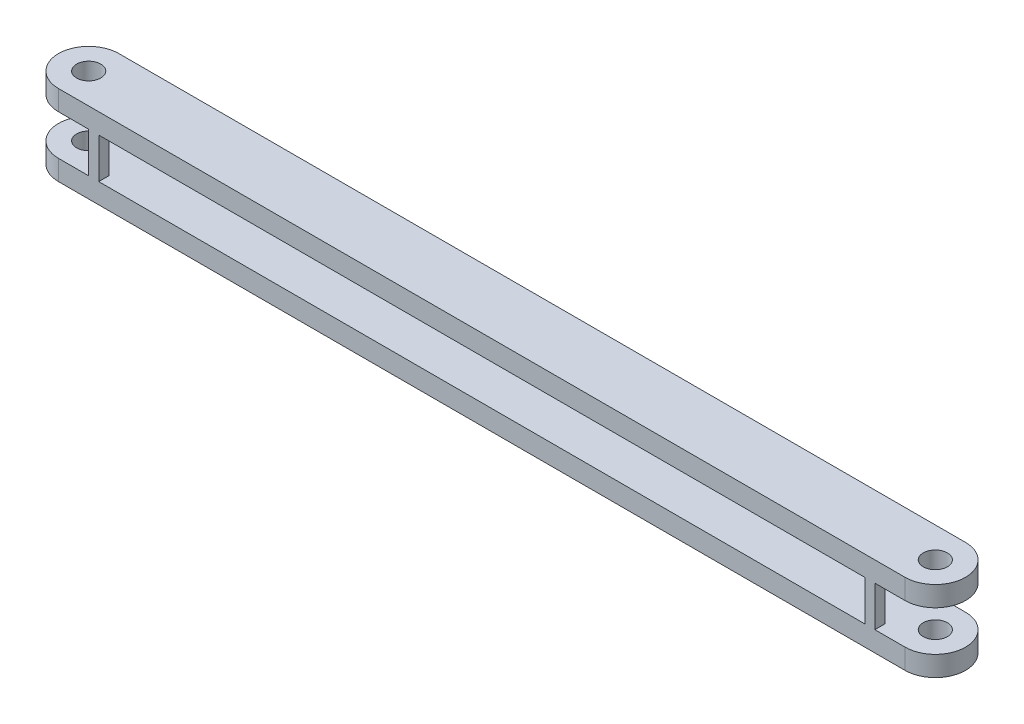
from build123d import *

# Parameters (mm, degrees)
EXTRUDE_1_DEPTH     = 20
SKETCH_2_W          = 190
SKETCH_2_H          = 10
CUT_EXTRUDE_3_DEPTH = 116.244305716
SKETCH_3_W          = 15
SKETCH_3_H          = 10
CUT_EXTRUDE_4_DEPTH = 116.244305716
SKETCH_4_W          = 10
SKETCH_4_H          = 10
CUT_EXTRUDE_5_DEPTH = 212.083514278
SKETCH_5_R          = 3
CUT_EXTRUDE_6_DEPTH = 115.509824906


with BuildPart() as part:
    # 草图1 → 凸台-拉伸1 (new body)
    with BuildSketch(Plane(origin=(0, 0, 0), x_dir=(1, 0, 0), z_dir=(0, 1, 0))):
        with BuildLine():
            Line((-105, 7.5), (105, 7.5))
            ThreePointArc((105, 7.5), (112.5, 0), (105, -7.5))
            Line((105, -7.5), (-105, -7.5))
            ThreePointArc((-105, -7.5), (-112.5, 0), (-105, 7.5))
        make_face()
    extrude(amount=EXTRUDE_1_DEPTH)

    # 草图2 → 切除-拉伸3 (cut, through all)
    with BuildSketch(Plane(origin=(0, 0, -7.5), x_dir=(-1, 0, 0), z_dir=(0, 0, -1))):
        with Locations((0, 10)):
            Rectangle(SKETCH_2_W, SKETCH_2_H)
    extrude(amount=-CUT_EXTRUDE_3_DEPTH, mode=Mode.SUBTRACT)

    # 草图3 → 切除-拉伸4 (cut, through all)
    with BuildSketch(Plane(origin=(0, 0, -7.5), x_dir=(-1, 0, 0), z_dir=(0, 0, -1))):
        with Locations((105, 10)):
            Rectangle(SKETCH_3_W, SKETCH_3_H)
        with Locations((-105, 10)):
            Rectangle(SKETCH_3_W, SKETCH_3_H)
    extrude(amount=-CUT_EXTRUDE_4_DEPTH, mode=Mode.SUBTRACT)

    # 草图4 → 切除-拉伸5 (cut, through all)
    with BuildSketch(Plane.ZY.offset(97.5)):
        with Locations((0, 10)):
            Rectangle(SKETCH_4_W, SKETCH_4_H)
    extrude(amount=-CUT_EXTRUDE_5_DEPTH, mode=Mode.SUBTRACT)

    # 草图5 → 切除-拉伸6 (cut, through all)
    with BuildSketch(Plane(origin=(0, 20, 0), x_dir=(1, 0, 0), z_dir=(0, 1, 0))):
        with Locations((-105, 0)):
            Circle(SKETCH_5_R)
        with Locations((105, 0)):
            Circle(SKETCH_5_R)
    extrude(amount=-CUT_EXTRUDE_6_DEPTH, mode=Mode.SUBTRACT)


solid = part.part
